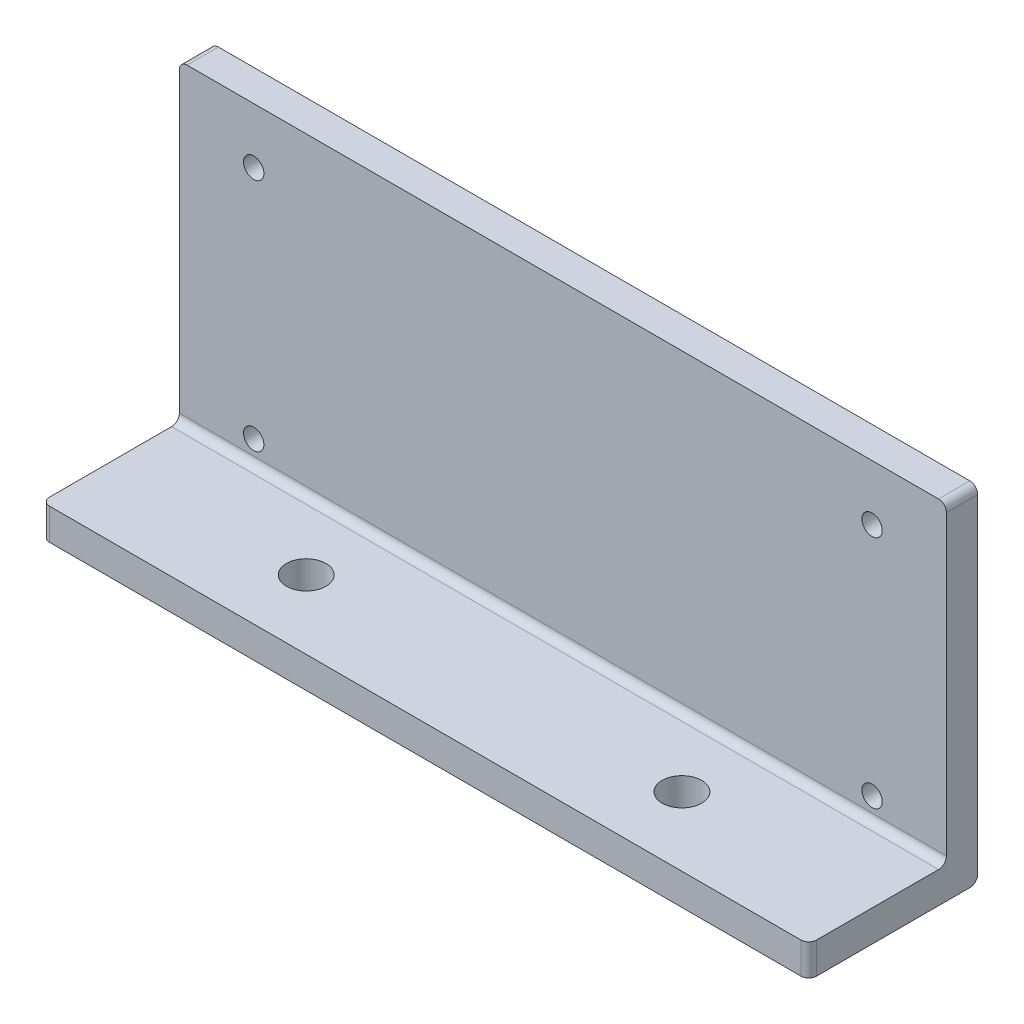
from build123d import *

# Parameters (mm, degrees)
SKETCH1_W                  = 98
SKETCH1_H                  = 21.59
BOSS_EXTRUDE1_DEPTH        = 4
SKETCH2_W                  = 98
SKETCH2_H                  = 4
BOSS_EXTRUDE2_DEPTH        = 40
FILLET1_R                  = 1
M2_CLEARANCE_HOLE1_D       = 2.6
F_8_0_199_DIAMETER_HOLE1_D = 5.0546


with BuildPart() as part:
    # Sketch1 → Boss-Extrude1 (new body)
    with BuildSketch(Plane(origin=(0, 0, 0), x_dir=(1, 0, 0), z_dir=(0, 1, 0))):
        Rectangle(SKETCH1_W, SKETCH1_H)
    extrude(amount=BOSS_EXTRUDE1_DEPTH)

    # Sketch2 → Boss-Extrude2 (add)
    with BuildSketch(Plane(origin=(0, 4, 0), x_dir=(1, 0, 0), z_dir=(0, 1, 0))):
        with Locations((0, 8.795)):
            Rectangle(SKETCH2_W, SKETCH2_H)
    extrude(amount=BOSS_EXTRUDE2_DEPTH)

    # Fillet1
    fillet1_edges = [part.edges().sort_by_distance(p)[0] for p in [
        (0, 0, -10.795),
        (0, 4, -6.795),
        (49, 2, 10.795),
        (-49, 44, -8.795),
        (49, 44, -8.795),
        (-49, 2, 10.795),
    ]]
    fillet(fillet1_edges, radius=FILLET1_R)

    # M2 Clearance Hole1 (through all)
    with Locations(Plane(origin=(39.5, 36.904051391, -6.795), x_dir=(1, 0, 0), z_dir=(0, 0, 1))):
        with Locations((0, 0), (0, -30), (-79, 0), (-79, -30)):
            Hole(M2_CLEARANCE_HOLE1_D / 2)

    # #8 (0.199) Diameter Hole1 (through all)
    with Locations(Plane(origin=(-24, 4, 2), x_dir=(0, 0, 1), z_dir=(0, 1, 0))):
        with Locations((0, 0), (0, 48)):
            Hole(F_8_0_199_DIAMETER_HOLE1_D / 2)


solid = part.part
